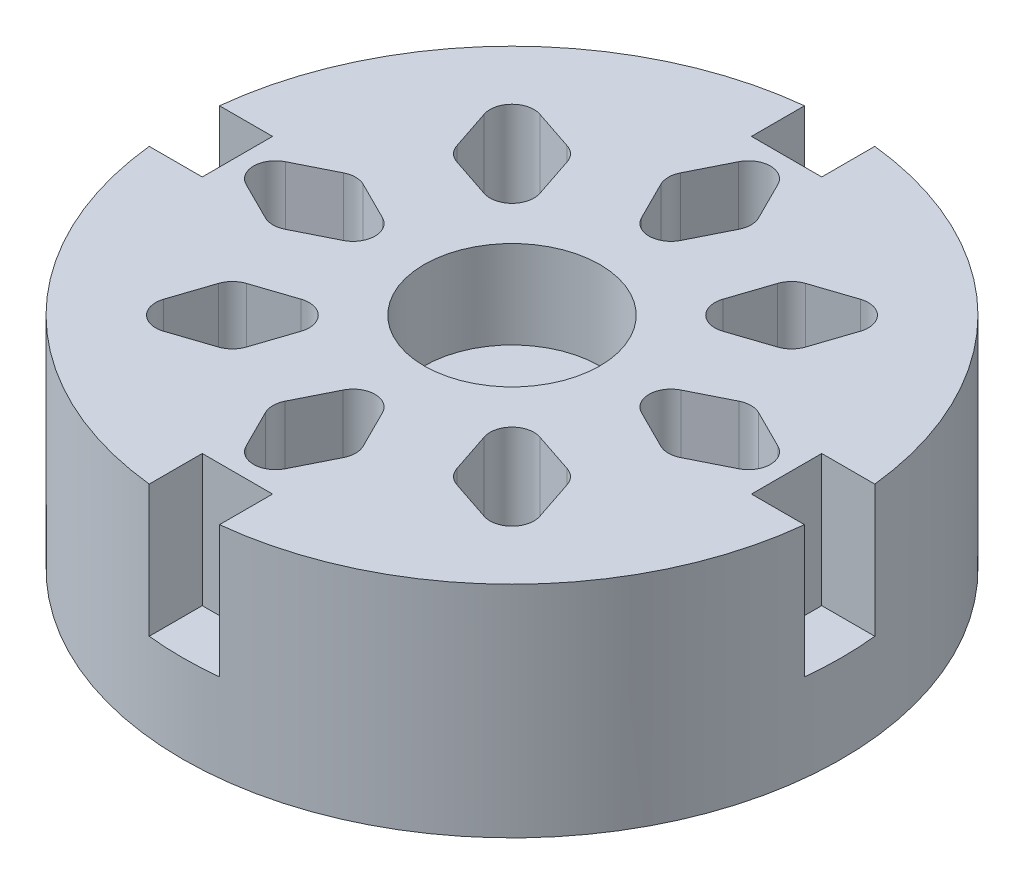
from build123d import *

# Parameters (mm, degrees)
SKETCH_1_R               = 15
SKETCH_1_R_2             = 4
EXTRUDE_1_DEPTH          = 10
SKETCH_4_R               = 15
EXTRUDE_2_DEPTH          = 6
CUT_EXTRUDE_2_DEPTH      = 23.045407685
CUT_EXTRUDE_2_DEPTH_BACK = 23.045407685
SKETCH_5_R               = 1.6
CUT_EXTRUDE_3_DEPTH      = 24.452078799
CUT_EXTRUDE_3_DEPTH_BACK = 24.452078799
SKETCH_8_W               = 3.2
SKETCH_8_H               = 5
SKETCH_8_W_2             = 5
SKETCH_8_H_2             = 3.2
CUT_EXTRUDE_4_DEPTH      = 6
SKETCH_9_R               = 3
CUT_EXTRUDE_5_DEPTH      = 2


with BuildPart() as part:
    # Эскиз1 → Бобышка-Вытянуть1 (new body)
    with BuildSketch(Plane(origin=(0, 0, 0), x_dir=(1, 0, 0), z_dir=(0, 1, 0))):
        Circle(SKETCH_1_R)
        Circle(SKETCH_1_R_2, mode=Mode.SUBTRACT)
    extrude(amount=EXTRUDE_1_DEPTH)

    # Эскиз4 → Бобышка-Вытянуть2 (add)
    with BuildSketch(Plane.XZ):
        Circle(SKETCH_4_R)
    extrude(amount=-EXTRUDE_2_DEPTH)

    # Эскиз5 → Вырез-Вытянуть2 (cut, two sides: drawn at the far end of the back side and taken through both)
    with BuildSketch(Plane(origin=(0, 6, 0), x_dir=(1, 0, 0), z_dir=(0, 1, 0)).offset(-CUT_EXTRUDE_2_DEPTH_BACK)):
        Circle(SKETCH_5_R)
    extrude(amount=CUT_EXTRUDE_2_DEPTH + CUT_EXTRUDE_2_DEPTH_BACK, mode=Mode.SUBTRACT)

    # Эскиз6 → Вырез-Вытянуть3 (cut, two sides: drawn at the far end of the back side and taken through both)
    with BuildSketch(Plane.XZ.offset(-CUT_EXTRUDE_3_DEPTH_BACK)):
        with BuildLine():
            Line((-6.788854382, 0.894427191), (-8.552786405, 1.776393202))
            ThreePointArc((-8.552786405, 1.776393202), (-9, 1.881966011), (-9.447213595, 1.776393202))
            Line((-9.447213595, 1.776393202), (-11.211145618, 0.894427191))
            ThreePointArc((-11.211145618, 0.894427191), (-11.763932023, 0), (-11.211145618, -0.894427191))
            Line((-11.211145618, -0.894427191), (-9.447213595, -1.776393202))
            ThreePointArc((-9.447213595, -1.776393202), (-9, -1.881966011), (-8.552786405, -1.776393202))
            Line((-8.552786405, -1.776393202), (-6.788854382, -0.894427191))
            ThreePointArc((-6.788854382, -0.894427191), (-6.236067977, 0), (-6.788854382, 0.894427191))
        make_face()
        with BuildLine():
            Line((-4.167989438, 5.432900502), (-4.791633585, 7.303832944))
            ThreePointArc((-4.791633585, 7.303832944), (-5.033210102, 7.694711959), (-5.424089117, 7.936288476))
            Line((-5.424089117, 7.936288476), (-7.295021559, 8.559932623))
            ThreePointArc((-7.295021559, 8.559932623), (-8.318356107, 8.318356107), (-8.559932623, 7.295021559))
            Line((-8.559932623, 7.295021559), (-7.936288476, 5.424089117))
            ThreePointArc((-7.936288476, 5.424089117), (-7.694711959, 5.033210102), (-7.303832944, 4.791633585))
            Line((-7.303832944, 4.791633585), (-5.432900502, 4.167989438))
            ThreePointArc((-5.432900502, 4.167989438), (-4.409565955, 4.409565955), (-4.167989438, 5.432900502))
        make_face()
        with BuildLine():
            Line((0.894427191, 6.788854382), (1.776393202, 8.552786405))
            ThreePointArc((1.776393202, 8.552786405), (1.881966011, 9), (1.776393202, 9.447213595))
            Line((1.776393202, 9.447213595), (0.894427191, 11.211145618))
            ThreePointArc((0.894427191, 11.211145618), (0, 11.763932023), (-0.894427191, 11.211145618))
            Line((-0.894427191, 11.211145618), (-1.776393202, 9.447213595))
            ThreePointArc((-1.776393202, 9.447213595), (-1.881966011, 9), (-1.776393202, 8.552786405))
            Line((-1.776393202, 8.552786405), (-0.894427191, 6.788854382))
            ThreePointArc((-0.894427191, 6.788854382), (0, 6.236067977), (0.894427191, 6.788854382))
        make_face()
        with BuildLine():
            Line((5.432900502, 4.167989438), (7.303832944, 4.791633585))
            ThreePointArc((7.303832944, 4.791633585), (7.694711959, 5.033210102), (7.936288476, 5.424089117))
            Line((7.936288476, 5.424089117), (8.559932623, 7.295021559))
            ThreePointArc((8.559932623, 7.295021559), (8.318356107, 8.318356107), (7.295021559, 8.559932623))
            Line((7.295021559, 8.559932623), (5.424089117, 7.936288476))
            ThreePointArc((5.424089117, 7.936288476), (5.033210102, 7.694711959), (4.791633585, 7.303832944))
            Line((4.791633585, 7.303832944), (4.167989438, 5.432900502))
            ThreePointArc((4.167989438, 5.432900502), (4.409565955, 4.409565955), (5.432900502, 4.167989438))
        make_face()
        with BuildLine():
            Line((6.788854382, -0.894427191), (8.552786405, -1.776393202))
            ThreePointArc((8.552786405, -1.776393202), (9, -1.881966011), (9.447213595, -1.776393202))
            Line((9.447213595, -1.776393202), (11.211145618, -0.894427191))
            ThreePointArc((11.211145618, -0.894427191), (11.763932023, 0), (11.211145618, 0.894427191))
            Line((11.211145618, 0.894427191), (9.447213595, 1.776393202))
            ThreePointArc((9.447213595, 1.776393202), (9, 1.881966011), (8.552786405, 1.776393202))
            Line((8.552786405, 1.776393202), (6.788854382, 0.894427191))
            ThreePointArc((6.788854382, 0.894427191), (6.236067977, 0), (6.788854382, -0.894427191))
        make_face()
        with BuildLine():
            Line((4.167989438, -5.432900502), (4.791633585, -7.303832944))
            ThreePointArc((4.791633585, -7.303832944), (5.033210102, -7.694711959), (5.424089117, -7.936288476))
            Line((5.424089117, -7.936288476), (7.295021559, -8.559932623))
            ThreePointArc((7.295021559, -8.559932623), (8.318356107, -8.318356107), (8.559932623, -7.295021559))
            Line((8.559932623, -7.295021559), (7.936288476, -5.424089117))
            ThreePointArc((7.936288476, -5.424089117), (7.694711959, -5.033210102), (7.303832944, -4.791633585))
            Line((7.303832944, -4.791633585), (5.432900502, -4.167989438))
            ThreePointArc((5.432900502, -4.167989438), (4.409565955, -4.409565955), (4.167989438, -5.432900502))
        make_face()
        with BuildLine():
            Line((-0.894427191, -6.788854382), (-1.776393202, -8.552786405))
            ThreePointArc((-1.776393202, -8.552786405), (-1.881966011, -9), (-1.776393202, -9.447213595))
            Line((-1.776393202, -9.447213595), (-0.894427191, -11.211145618))
            ThreePointArc((-0.894427191, -11.211145618), (0, -11.763932023), (0.894427191, -11.211145618))
            Line((0.894427191, -11.211145618), (1.776393202, -9.447213595))
            ThreePointArc((1.776393202, -9.447213595), (1.881966011, -9), (1.776393202, -8.552786405))
            Line((1.776393202, -8.552786405), (0.894427191, -6.788854382))
            ThreePointArc((0.894427191, -6.788854382), (0, -6.236067977), (-0.894427191, -6.788854382))
        make_face()
        with BuildLine():
            Line((-5.432900502, -4.167989438), (-7.303832944, -4.791633585))
            ThreePointArc((-7.303832944, -4.791633585), (-7.694711959, -5.033210102), (-7.936288476, -5.424089117))
            Line((-7.936288476, -5.424089117), (-8.559932623, -7.295021559))
            ThreePointArc((-8.559932623, -7.295021559), (-8.318356107, -8.318356107), (-7.295021559, -8.559932623))
            Line((-7.295021559, -8.559932623), (-5.424089117, -7.936288476))
            ThreePointArc((-5.424089117, -7.936288476), (-5.033210102, -7.694711959), (-4.791633585, -7.303832944))
            Line((-4.791633585, -7.303832944), (-4.167989438, -5.432900502))
            ThreePointArc((-4.167989438, -5.432900502), (-4.409565955, -4.409565955), (-5.432900502, -4.167989438))
        make_face()
    extrude(amount=CUT_EXTRUDE_3_DEPTH + CUT_EXTRUDE_3_DEPTH_BACK, mode=Mode.SUBTRACT)

    # Эскиз8 → Вырез-Вытянуть4 (cut)
    with BuildSketch(Plane(origin=(0, 10, 0), x_dir=(1, 0, 0), z_dir=(0, 1, 0))):
        with Locations((0, 15)):
            Rectangle(SKETCH_8_W, SKETCH_8_H)
        with Locations((-15, 0)):
            Rectangle(SKETCH_8_W_2, SKETCH_8_H_2)
        with Locations((15, 0)):
            Rectangle(SKETCH_8_W_2, SKETCH_8_H_2)
        with Locations((0, -15)):
            Rectangle(SKETCH_8_W, SKETCH_8_H)
    extrude(amount=-CUT_EXTRUDE_4_DEPTH, mode=Mode.SUBTRACT)

    # Эскиз9 → Вырез-Вытянуть5 (cut)
    with BuildSketch(Plane.XZ):
        Circle(SKETCH_9_R)
    extrude(amount=-CUT_EXTRUDE_5_DEPTH, mode=Mode.SUBTRACT)


solid = part.part
